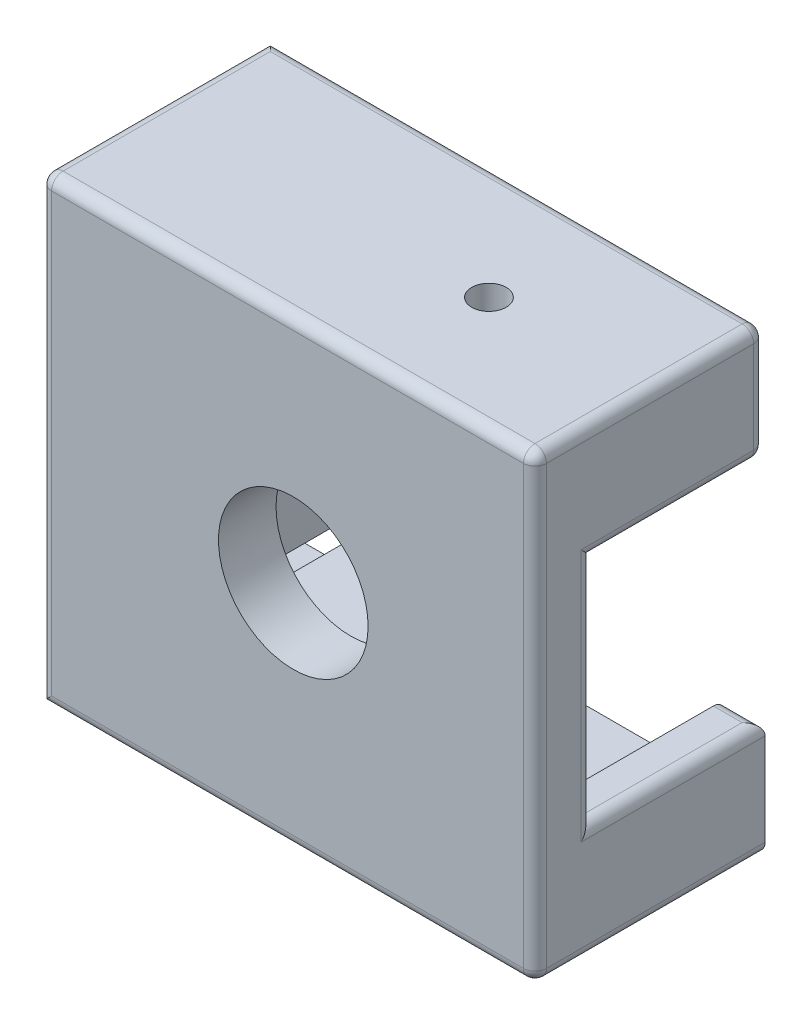
from build123d import *

# Parameters (mm, degrees)
SKETCH1_W           = 43
SKETCH1_H           = 40
BOSS_EXTRUDE1_DEPTH = 5
SKETCH2_W           = 13
SKETCH2_H           = 2
SKETCH2_W_2         = 17.5
SKETCH2_W_3         = 2.5
SKETCH2_H_2         = 10
BOSS_EXTRUDE3_DEPTH = 8
BOSS_EXTRUDE4_DEPTH = 15
SKETCH4_R           = 1.5
CUT_EXTRUDE1_DEPTH  = 65
SKETCH6_R           = 1.5
CUT_EXTRUDE2_DEPTH  = 10
SKETCH7_R           = 6.5
CUT_EXTRUDE3_DEPTH  = 20
SKETCH8_W           = 15
SKETCH8_H           = 20
CUT_EXTRUDE4_DEPTH  = 5
FILLET1_R           = 1
FILLET2_R           = 1


with BuildPart() as part:
    # Sketch1 → Boss-Extrude1 (new body)
    with BuildSketch(Plane.XY):
        with Locations((75.504805995, -8.785410368)):
            Rectangle(SKETCH1_W, SKETCH1_H)
    extrude(amount=BOSS_EXTRUDE1_DEPTH)

    # Sketch2 → Boss-Extrude3 (add)
    with BuildSketch(Plane(origin=(0, 0, 0), x_dir=(-1, 0, 0), z_dir=(0, 0, -1))):
        with Locations((-79.004805995, -0.485410368)):
            Rectangle(SKETCH2_W, SKETCH2_H)
        with Locations((-76.754805995, -16.985410368)):
            Rectangle(SKETCH2_W_2, SKETCH2_H)
        with Locations((-66.754805995, -9.285410368)):
            Rectangle(SKETCH2_W_3, SKETCH2_H_2)
    extrude(amount=BOSS_EXTRUDE3_DEPTH)

    # Sketch3 → Boss-Extrude4 (add)
    with BuildSketch(Plane(origin=(0, 0, 0), x_dir=(-1, 0, 0), z_dir=(0, 0, -1))):
        Polygon((-54.004805995, 11.214589632), (-97.004805995, 11.214589632), (-97.004805995, -28.785410368), (-54.004805995, -28.785410368), (-54.004805995, -25.285410368), (-93.504805995, -25.285410368), (-93.504805995, 7.714589632), (-54.004805995, 7.714589632), align=None)
    extrude(amount=BOSS_EXTRUDE4_DEPTH)

    # Sketch4 → Cut-Extrude1 (cut)
    with BuildSketch(Plane(origin=(0, 11.214589632, 0), x_dir=(1, 0, 0), z_dir=(0, 1, 0))):
        with Locations((83.004805995, 5)):
            Circle(SKETCH4_R)
    extrude(amount=-CUT_EXTRUDE1_DEPTH, mode=Mode.SUBTRACT)

    # Sketch6 → Cut-Extrude2 (cut)
    with BuildSketch(Plane.XZ.offset(28.785410368)):
        with Locations((60.004805995, -5)):
            Circle(SKETCH6_R)
    extrude(amount=-CUT_EXTRUDE2_DEPTH, mode=Mode.SUBTRACT)

    # Sketch7 → Cut-Extrude3 (cut)
    with BuildSketch(Plane.XY.offset(5)):
        with Locations((76.004805995, -8.785410368)):
            Circle(SKETCH7_R)
    extrude(amount=-CUT_EXTRUDE3_DEPTH, mode=Mode.SUBTRACT)

    # Sketch8 → Cut-Extrude4 (cut)
    with BuildSketch(Plane(origin=(97.004805995, 0, 0), x_dir=(0, 0, -1), z_dir=(1, 0, 0))):
        with Locations((7.5, -8.785410368)):
            Rectangle(SKETCH8_W, SKETCH8_H)
    extrude(amount=-CUT_EXTRUDE4_DEPTH, mode=Mode.SUBTRACT)

    # Fillet1
    fillet1_edges = [part.edges().sort_by_distance(p)[0] for p in [
        (54.004805995, 11.214589632, -5),
        (54.004805995, -8.785410368, 5),
        (75.504805995, -28.785410368, 5),
        (97.004805995, -28.785410368, -5),
        (97.004805995, -8.785410368, 5),
        (75.504805995, 11.214589632, 5),
        (97.004805995, 11.214589632, -5),
        (97.004805995, 6.214589632, -15),
        (75.504805995, 11.214589632, -15),
    ]]
    fillet(fillet1_edges, radius=FILLET1_R)

    # Fillet2
    fillet2_edges = [part.edges().sort_by_distance(p)[0] for p in [
        (96.711912776, 1.214589632, -14.707106781),
        (94.754805995, 1.214589632, -15),
        (95.254805995, -18.785410368, -15),
        (97.004805995, -8.785410368, 0),
        (97.004805995, 1.214589632, -7),
        (97.004805995, -18.785410368, -7.5),
    ]]
    fillet(fillet2_edges, radius=FILLET2_R)


solid = part.part
